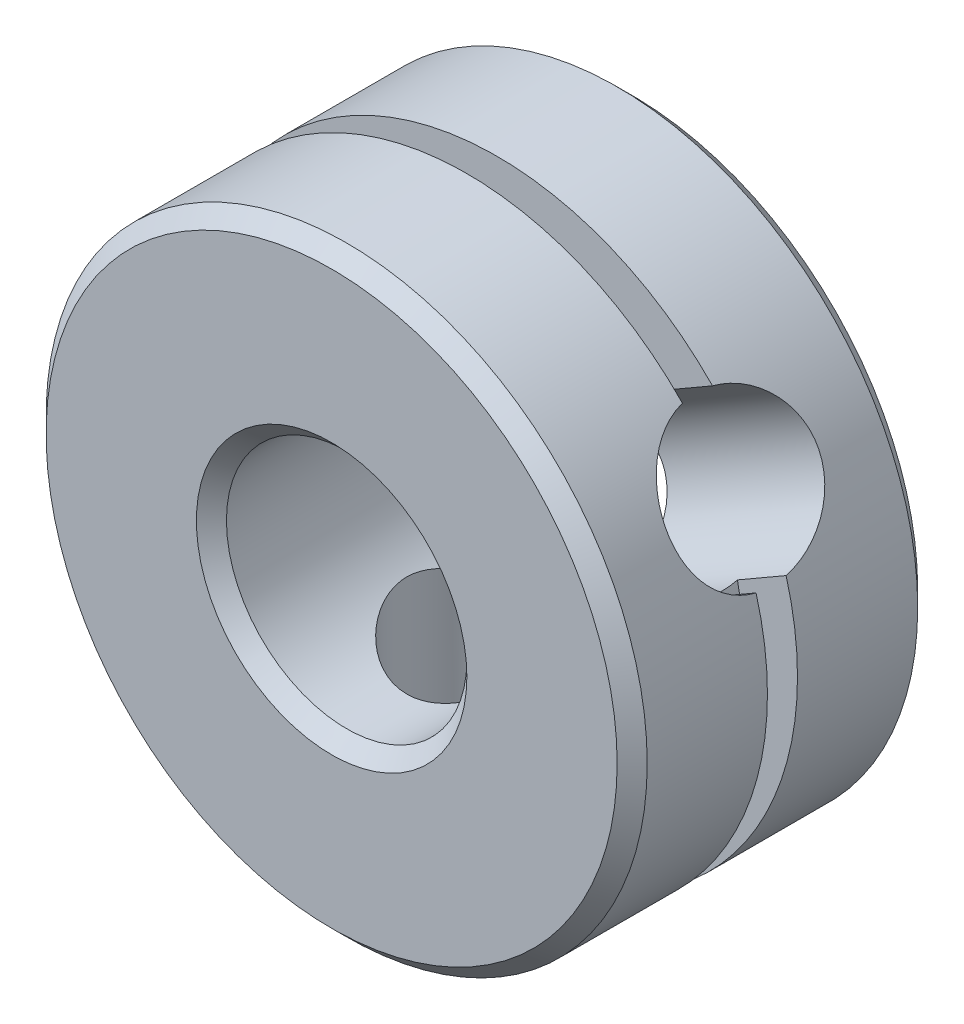
from build123d import *

# Parameters (mm, degrees)
SKETCH1_R          = 10
SKETCH1_R_2        = 4
BASE_EXTRUDE_DEPTH = 10
CHAMFER1_SIZE      = 0.5
SKETCH2_R          = 2.5
HOLE_DEPTH         = 18.320508076
HOLEPAT_COUNT      = 2
HOLEPAT_ANGLE      = 120
ENDCHAMFER_SIZE    = 0.5
SKETCH3_W          = 1.8
SKETCH3_H          = 1


with BuildPart() as part:
    # Sketch1 → Base-Extrude (new body)
    with BuildSketch(Plane.XY):
        Circle(SKETCH1_R)
        Circle(SKETCH1_R_2, mode=Mode.SUBTRACT)
    extrude(amount=-BASE_EXTRUDE_DEPTH)

    # Chamfer1
    chamfer1_edges = [part.edges().sort_by_distance(p)[0] for p in [
        (-10, 0, -10),
        (-10, 0, 0),
    ]]
    chamfer(chamfer1_edges, length=CHAMFER1_SIZE)

    # Sketch2 → Hole (cut, through all)
    with BuildSketch(Plane(origin=(0, 0, 0), x_dir=(1, 0, 0), z_dir=(0, 1, 0))):
        with Locations((0, 5)):
            Circle(SKETCH2_R)
    hole = extrude(amount=-HOLE_DEPTH, mode=Mode.SUBTRACT)

    # HolePat: Hole ×2 about axis
    holepat_axis = Axis((0, 0, -10), (0, 0, 1))
    for i in range(1, HOLEPAT_COUNT):
        add(hole.rotate(holepat_axis, i * HOLEPAT_ANGLE / (HOLEPAT_COUNT - 1)), mode=Mode.SUBTRACT)

    # EndChamfer
    endchamfer_edges = [part.edges().sort_by_distance(p)[0] for p in [
        (-4, 0, -10),
        (-4, 0, 0),
    ]]
    chamfer(endchamfer_edges, length=ENDCHAMFER_SIZE)

    # Sketch3 → Slot (revolve, cut)
    with BuildSketch(Plane(origin=(0, 0, 0), x_dir=(1, 0, 0), z_dir=(0, 1, 0))):
        with Locations((-9.1, 5)):
            Rectangle(SKETCH3_W, SKETCH3_H)
    revolve(axis=Axis((0, 0, -2.359307359), (0, 0, 1)), mode=Mode.SUBTRACT)


solid = part.part
